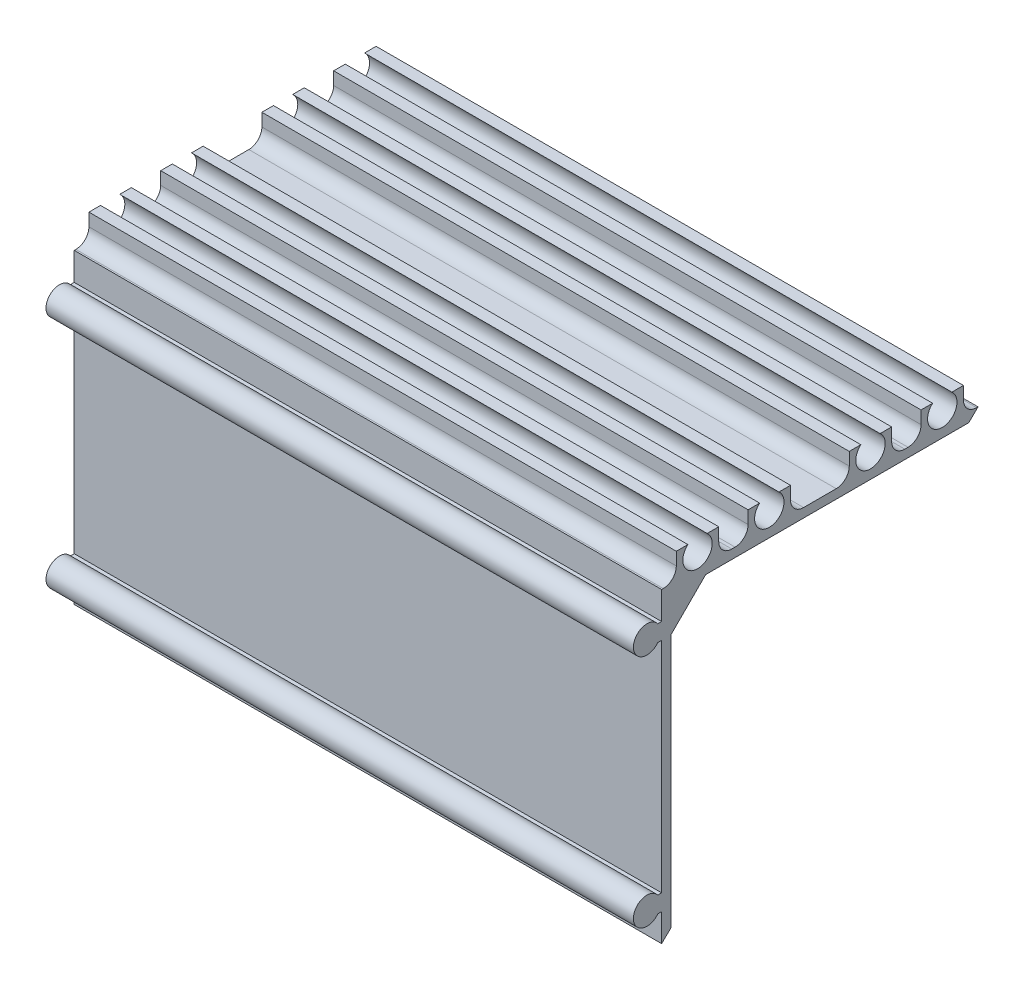
from build123d import *

# Parameters (mm, degrees)
EXTRUDE_1_DEPTH             = 90
SKETCH_2_W                  = 90
SKETCH_2_H                  = 42.75
EXTRUDE_2_DEPTH             = 8.2
SKETCH_3_W                  = 90
SKETCH_3_H                  = 52.45
EXTRUDE_3_DEPTH             = 8.2
SKETCH_4_W                  = 3.95
SKETCH_4_H                  = 2.25
CUT_EXTRUDE_1_DEPTH         = 235.487383722
SKETCH_5_W                  = 3.95
SKETCH_5_H                  = 29.5
CUT_EXTRUDE_2_DEPTH         = 235.487383722
SKETCH_6_W                  = 3.95
SKETCH_6_H                  = 6.2
CUT_EXTRUDE_3_DEPTH         = 235.487383722
SKETCH_7_W                  = 2.25
SKETCH_7_H                  = 3.95
CUT_EXTRUDE_4_DEPTH         = 235.487383722
SKETCH_8_W                  = 4.5
SKETCH_8_H                  = 3.95
CUT_EXTRUDE_5_DEPTH         = 235.487383722
SKETCH_9_W                  = 9
SKETCH_9_H                  = 3.95
CUT_EXTRUDE_6_DEPTH         = 235.487383722
SKETCH_10_W                 = 4.5
SKETCH_10_H                 = 3.95
CUT_EXTRUDE_7_DEPTH         = 235.487383722
SKETCH_11_W                 = 2.25
SKETCH_11_H                 = 3.95
CUT_EXTRUDE_8_DEPTH         = 235.487383722
SKETCH_12_W                 = 45.7
SKETCH_12_H                 = 44.2
CUT_EXTRUDE_9_DEPTH         = 86
HOLE_WIZARD_2_5_2_5_1_D     = 2.5
HOLE_WIZARD_4_5_4_5_1_D     = 4.5
HOLE_WIZARD_8_3_8_3_1_D     = 8.3
HOLE_WIZARD_8_3_8_3_1_DEPTH = 3.2
SKETCH_19_R                 = 1.67252853
SKETCH_19_R_2               = 1.459159852
SKETCH_19_R_3               = 1.459908976
SKETCH_19_R_4               = 1.592821911
SKETCH_19_R_5               = 1.532216665
SKETCH_19_R_6               = 1.596138091
EXTRUDE_4_DEPTH             = 90
CUT_EXTRUDE_START           = -90
SKETCH_20_R                 = 4.15
CUT_EXTRUDE_10_DEPTH        = 90
FILLET_1_R                  = 2
FILLET_2_R                  = 2
FILLET_3_R                  = 2
FILLET_4_R                  = 2
FILLET_5_R                  = 2
FILLET_6_R                  = 2
FILLET_7_R                  = 2
FILLET_8_R                  = 2
FILLET_9_R                  = 2
FILLET_10_R                 = 2
FILLET_11_R                 = 2
FILLET_12_R                 = 2
FILLET_13_R                 = 1.2
CUT_EXTRUDE_12_DEPTH        = 150
CUT_EXTRUDE_13_DEPTH        = 39
EXTRUDE_5_DEPTH             = 4
EXTRUDE_6_DEPTH             = 88


with BuildPart() as part:
    # Эскиз1 → Бобышка-Вытянуть1 (new body)
    with BuildSketch(Plane(origin=(90, 0, 0), x_dir=(0, 0, -1), z_dir=(1, 0, 0))):
        with BuildLine():
            Line((6.75, 160.906238208), (6.75, 204.25))
            Line((6.75, 204.25), (-38.093761792, 204.25))
            ThreePointArc((-38.093761792, 204.25), (-41.825, 203), (-38.093761792, 201.75))
            Line((-38.093761792, 201.75), (-37.5, 201.75))
            Line((-37.5, 201.75), (-37.5, 168.25))
            Line((-37.5, 168.25), (-38.093761792, 168.25))
            ThreePointArc((-38.093761792, 168.25), (-41.825, 167), (-38.093761792, 165.75))
            Line((-38.093761792, 165.75), (-37.5, 165.75))
            Line((-37.5, 165.75), (-37.5, 161.5))
            Line((-37.5, 161.5), (-33.25, 161.5))
            Line((-33.25, 161.5), (-33.25, 160.906238208))
            ThreePointArc((-33.25, 160.906238208), (-32, 157.175), (-30.75, 160.906238208))
            Line((-30.75, 160.906238208), (-30.75, 161.5))
            Line((-30.75, 161.5), (-22.25, 161.5))
            Line((-22.25, 161.5), (-22.25, 160.906238208))
            ThreePointArc((-22.25, 160.906238208), (-21, 157.175), (-19.75, 160.906238208))
            Line((-19.75, 160.906238208), (-19.75, 161.5))
            Line((-19.75, 161.5), (-6.75, 161.5))
            Line((-6.75, 161.5), (-6.75, 160.906238208))
            ThreePointArc((-6.75, 160.906238208), (-5.5, 157.175), (-4.25, 160.906238208))
            Line((-4.25, 160.906238208), (-4.25, 161.5))
            Line((-4.25, 161.5), (4.25, 161.5))
            Line((4.25, 161.5), (4.25, 160.906238208))
            ThreePointArc((4.25, 160.906238208), (5.5, 157.175), (6.75, 160.906238208))
        make_face()
    extrude(amount=-EXTRUDE_1_DEPTH)

    # Эскиз2 → Бобышка-Вытянуть2 (add)
    with BuildSketch(Plane(origin=(0, 0, -6.75), x_dir=(-1, 0, 0), z_dir=(0, 0, -1))):
        with Locations((-45, 182.875)):
            Rectangle(SKETCH_2_W, SKETCH_2_H)
    extrude(amount=EXTRUDE_2_DEPTH)

    # Эскиз3 → Бобышка-Вытянуть3 (add)
    with BuildSketch(Plane(origin=(0, 204.25, 0), x_dir=(-1, 0, 0), z_dir=(0, 1, 0))):
        with Locations((-45, 11.275)):
            Rectangle(SKETCH_3_W, SKETCH_3_H)
    extrude(amount=EXTRUDE_3_DEPTH)

    # Эскиз4 → Вырез-Вытянуть1 (cut, through all)
    with BuildSketch(Plane.ZY):
        with Locations((-12.975, 162.625)):
            Rectangle(SKETCH_4_W, SKETCH_4_H)
    extrude(amount=-CUT_EXTRUDE_1_DEPTH, mode=Mode.SUBTRACT)

    # Эскиз5 → Вырез-Вытянуть2 (cut, through all)
    with BuildSketch(Plane.ZY):
        with Locations((-12.975, 185)):
            Rectangle(SKETCH_5_W, SKETCH_5_H)
    extrude(amount=-CUT_EXTRUDE_2_DEPTH, mode=Mode.SUBTRACT)

    # Эскиз6 → Вырез-Вытянуть3 (cut, through all)
    with BuildSketch(Plane.ZY):
        with Locations((-12.975, 209.35)):
            Rectangle(SKETCH_6_W, SKETCH_6_H)
    extrude(amount=-CUT_EXTRUDE_3_DEPTH, mode=Mode.SUBTRACT)

    # Эскиз7 → Вырез-Вытянуть4 (cut, through all)
    with BuildSketch(Plane.ZY):
        with Locations((-9.875, 210.475)):
            Rectangle(SKETCH_7_W, SKETCH_7_H)
    extrude(amount=-CUT_EXTRUDE_4_DEPTH, mode=Mode.SUBTRACT)

    # Эскиз8 → Вырез-Вытянуть5 (cut, through all)
    with BuildSketch(Plane.ZY):
        with Locations((0, 210.475)):
            Rectangle(SKETCH_8_W, SKETCH_8_H)
    extrude(amount=-CUT_EXTRUDE_5_DEPTH, mode=Mode.SUBTRACT)

    # Эскиз9 → Вырез-Вытянуть6 (cut, through all)
    with BuildSketch(Plane.ZY):
        with Locations((13.25, 210.475)):
            Rectangle(SKETCH_9_W, SKETCH_9_H)
    extrude(amount=-CUT_EXTRUDE_6_DEPTH, mode=Mode.SUBTRACT)

    # Эскиз10 → Вырез-Вытянуть7 (cut, through all)
    with BuildSketch(Plane.ZY):
        with Locations((26.5, 210.475)):
            Rectangle(SKETCH_10_W, SKETCH_10_H)
    extrude(amount=-CUT_EXTRUDE_7_DEPTH, mode=Mode.SUBTRACT)

    # Эскиз11 → Вырез-Вытянуть8 (cut, through all)
    with BuildSketch(Plane.ZY):
        with Locations((36.375, 210.475)):
            Rectangle(SKETCH_11_W, SKETCH_11_H)
    extrude(amount=-CUT_EXTRUDE_8_DEPTH, mode=Mode.SUBTRACT)

    # Эскиз12 → Вырез-Вытянуть9 (cut)
    with BuildSketch(Plane(origin=(90, 0, 0), x_dir=(0, 0, -1), z_dir=(1, 0, 0))):
        with Locations((-13.25, 185)):
            Rectangle(SKETCH_12_W, SKETCH_12_H)
    extrude(amount=-CUT_EXTRUDE_9_DEPTH, mode=Mode.SUBTRACT)

    # Диаметр отверстия Ø2.5 (2.5)1 (through all)
    with Locations(Plane(origin=(90, 0, 0), x_dir=(0, 0, -1), z_dir=(1, 0, 0))):
        with Locations((5.5, 159.25), (-21, 159.25), (-5.5, 159.25), (-32, 159.25), (-39.75, 167), (-39.75, 203)):
            Hole(HOLE_WIZARD_2_5_2_5_1_D / 2)

    # Диаметр отверстия Ø4.5 (4.5)1 (through all)
    with Locations(Plane.ZY):
        with Locations((-13.25, 167), (-13.25, 203), (-5.5, 210.75), (5.5, 210.75), (21, 210.75), (32, 210.75)):
            Hole(HOLE_WIZARD_4_5_4_5_1_D / 2)

    # Диаметр отверстия Ø8.3 (8.3)1
    with Locations(Plane.ZY):
        with Locations((13.25, 185)):
            Hole(HOLE_WIZARD_8_3_8_3_1_D / 2, depth=HOLE_WIZARD_8_3_8_3_1_DEPTH)

    # Эскиз19 → Бобышка-Вытянуть4 (add)
    with BuildSketch(Plane(origin=(90, 0, 0), x_dir=(0, 0, -1), z_dir=(1, 0, 0))):
        with Locations((-39.75, 203)):
            Circle(SKETCH_19_R)
        with Locations((-39.75, 167)):
            Circle(SKETCH_19_R_2)
        with Locations((-32, 159.25)):
            Circle(SKETCH_19_R_3)
        with Locations((-21, 159.25)):
            Circle(SKETCH_19_R_4)
        with Locations((-5.5, 159.25)):
            Circle(SKETCH_19_R_5)
        with Locations((5.5, 159.25)):
            Circle(SKETCH_19_R_6)
    extrude(amount=-EXTRUDE_4_DEPTH)

    # Эскиз20 → Вырез-Вытянуть10 (cut)
    with BuildSketch(Plane.ZY.offset(CUT_EXTRUDE_START)):
        with Locations((13.25, 185)):
            Circle(SKETCH_20_R)
    extrude(amount=CUT_EXTRUDE_10_DEPTH, mode=Mode.SUBTRACT)

    # Скругление1
    fillet_1_edges = [part.edges().sort_by_distance(p)[0] for p in [
        (45, 208.5, -8.75),
    ]]
    fillet(fillet_1_edges, radius=FILLET_1_R)

    # Скругление2
    fillet_2_edges = [part.edges().sort_by_distance(p)[0] for p in [
        (45, 163.75, -11),
    ]]
    fillet(fillet_2_edges, radius=FILLET_2_R)

    # Скругление3
    fillet_3_edges = [part.edges().sort_by_distance(p)[0] for p in [
        (45, 170.25, -11),
    ]]
    fillet(fillet_3_edges, radius=FILLET_3_R)

    # Скругление4
    fillet_4_edges = [part.edges().sort_by_distance(p)[0] for p in [
        (45, 199.75, -11),
    ]]
    fillet(fillet_4_edges, radius=FILLET_4_R)

    # Скругление5
    fillet_5_edges = [part.edges().sort_by_distance(p)[0] for p in [
        (45, 206.25, -11),
    ]]
    fillet(fillet_5_edges, radius=FILLET_5_R)

    # Скругление6
    fillet_6_edges = [part.edges().sort_by_distance(p)[0] for p in [
        (45, 208.5, -2.25),
    ]]
    fillet(fillet_6_edges, radius=FILLET_6_R)

    # Скругление7
    fillet_7_edges = [part.edges().sort_by_distance(p)[0] for p in [
        (45, 208.5, 2.25),
    ]]
    fillet(fillet_7_edges, radius=FILLET_7_R)

    # Скругление8
    fillet_8_edges = [part.edges().sort_by_distance(p)[0] for p in [
        (45, 208.5, 8.75),
    ]]
    fillet(fillet_8_edges, radius=FILLET_8_R)

    # Скругление9
    fillet_9_edges = [part.edges().sort_by_distance(p)[0] for p in [
        (45, 208.5, 17.75),
    ]]
    fillet(fillet_9_edges, radius=FILLET_9_R)

    # Скругление10
    fillet_10_edges = [part.edges().sort_by_distance(p)[0] for p in [
        (45, 208.5, 24.25),
    ]]
    fillet(fillet_10_edges, radius=FILLET_10_R)

    # Скругление11
    fillet_11_edges = [part.edges().sort_by_distance(p)[0] for p in [
        (45, 208.5, 28.75),
    ]]
    fillet(fillet_11_edges, radius=FILLET_11_R)

    # Скругление12
    fillet_12_edges = [part.edges().sort_by_distance(p)[0] for p in [
        (45, 208.5, 35.25),
    ]]
    fillet(fillet_12_edges, radius=FILLET_12_R)

    # Скругление13
    fillet_13_edges = [part.edges().sort_by_distance(p)[0] for p in [
        (4, 185, -9.6),
        (4, 162.9, 13.25),
        (4, 185, 36.1),
        (4, 207.1, 13.25),
    ]]
    fillet(fillet_13_edges, radius=FILLET_13_R)

    # Эскиз21 → Вырез-Вытянуть12 (cut)
    with BuildSketch(Plane(origin=(90, 0, 0), x_dir=(0, 0, -1), z_dir=(1, 0, 0))):
        Polygon((30.296200346, 229.506902043), (10.767748913, 208.274931936), (-37.5, 161.5), (-46.097592317, 153.168312601), (30.296200346, 153.168312601), align=None)
    extrude(amount=-CUT_EXTRUDE_12_DEPTH, mode=Mode.SUBTRACT)

    # Эскиз22 → Вырез-Вытянуть13 (cut)
    with BuildSketch(Plane(origin=(4, 0, 0), x_dir=(0, 0, -1), z_dir=(1, 0, 0))):
        with BuildLine():
            Line((-29.9, 205.9), (-29.9, 168.864948454))
            Line((-29.9, 168.864948454), (-16.230217065, 182.111954597))
            ThreePointArc((-16.230217065, 182.111954597), (-16.138045403, 187.980217065), (-10.269782935, 187.888045403))
            Line((-10.269782935, 187.888045403), (8.317021277, 205.9))
            Line((8.317021277, 205.9), (-29.9, 205.9))
        make_face()
    extrude(amount=-CUT_EXTRUDE_13_DEPTH, mode=Mode.SUBTRACT)

    # Эскиз23 → Бобышка-Вытянуть5 (add)
    with BuildSketch(Plane(origin=(4, 0, 0), x_dir=(0, 0, -1), z_dir=(1, 0, 0))):
        Polygon((-29.9, 205.9), (-29.9, 185.9), (-19.75, 205.9), align=None)
    extrude(amount=-EXTRUDE_5_DEPTH)

    # Эскиз24 → Бобышка-Вытянуть6 (add)
    with BuildSketch(Plane(origin=(90, 0, 0), x_dir=(0, 0, -1), z_dir=(1, 0, 0))):
        Polygon((-36.1, 207.1), (-36.1, 201.75), (-30.75, 207.1), align=None)
    extrude(amount=-EXTRUDE_6_DEPTH)


solid = part.part
